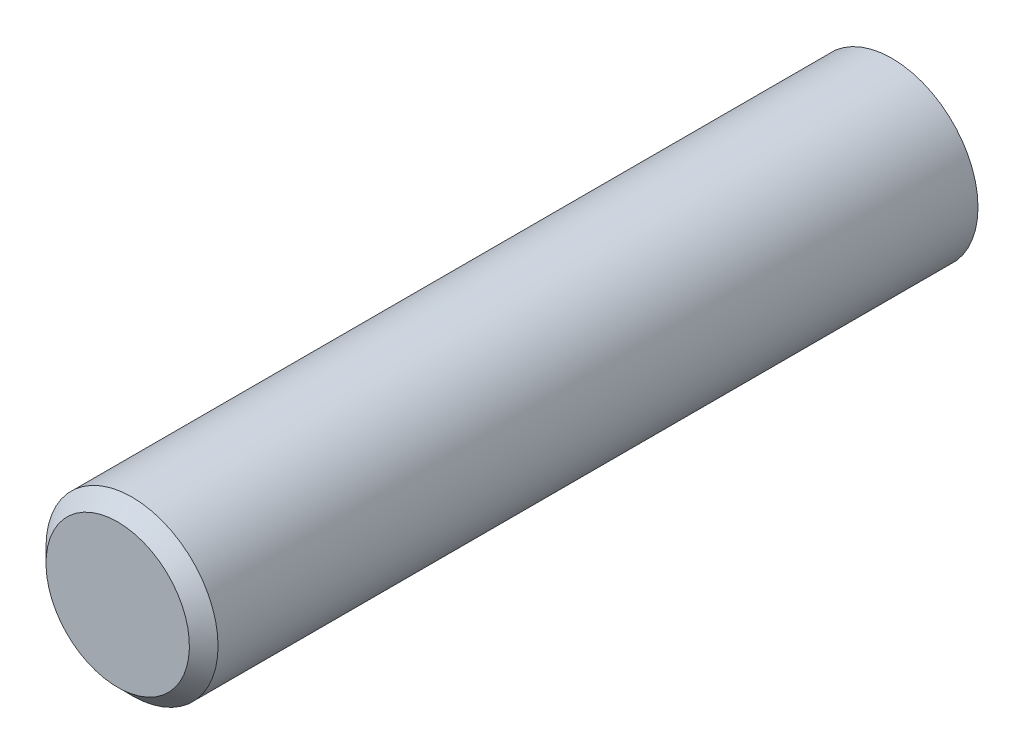
from build123d import *

# Parameters (mm, degrees)
F_3_1_3_175_DURCHMESSER_BOHRUNG1_D     = 3.175
F_3_1_3_175_DURCHMESSER_BOHRUNG1_DEPTH = 10
F_3_1_3_175_DURCHMESSER_BOHRUNG1_TIP   = 0.953866233
FASE1_SIZE                             = 0.5


with BuildPart() as part:
    # Skizze1 → Rotation1 (revolve)
    with BuildSketch(Plane(origin=(85, 0, 0), x_dir=(0, 0, -1), z_dir=(1, 0, 0))):
        Polygon((-2, 3), (-2, 0), (-22, 0), (-29, 0), (-29, 3), (-22, 3), align=None)
    revolve(axis=Axis((85, 0, 22), (0, 0, -1)))

    # Ø3.1 (3.175) Durchmesser Bohrung1
    with Locations(Plane(origin=(0, 0, 2), x_dir=(-1, 0, 0), z_dir=(0, 0, -1))):
        with Locations((-85, 0)):
            Hole(F_3_1_3_175_DURCHMESSER_BOHRUNG1_D / 2, depth=F_3_1_3_175_DURCHMESSER_BOHRUNG1_DEPTH)
            with Locations((0, 0, -(F_3_1_3_175_DURCHMESSER_BOHRUNG1_DEPTH + F_3_1_3_175_DURCHMESSER_BOHRUNG1_TIP / 2))):  # 118° drill point
                Cone(0, F_3_1_3_175_DURCHMESSER_BOHRUNG1_D / 2, F_3_1_3_175_DURCHMESSER_BOHRUNG1_TIP, mode=Mode.SUBTRACT)

    # Fase1
    fase1_edges = [part.edges().sort_by_distance(p)[0] for p in [
        (85, -3, 29),
    ]]
    chamfer(fase1_edges, length=FASE1_SIZE)


solid = part.part
